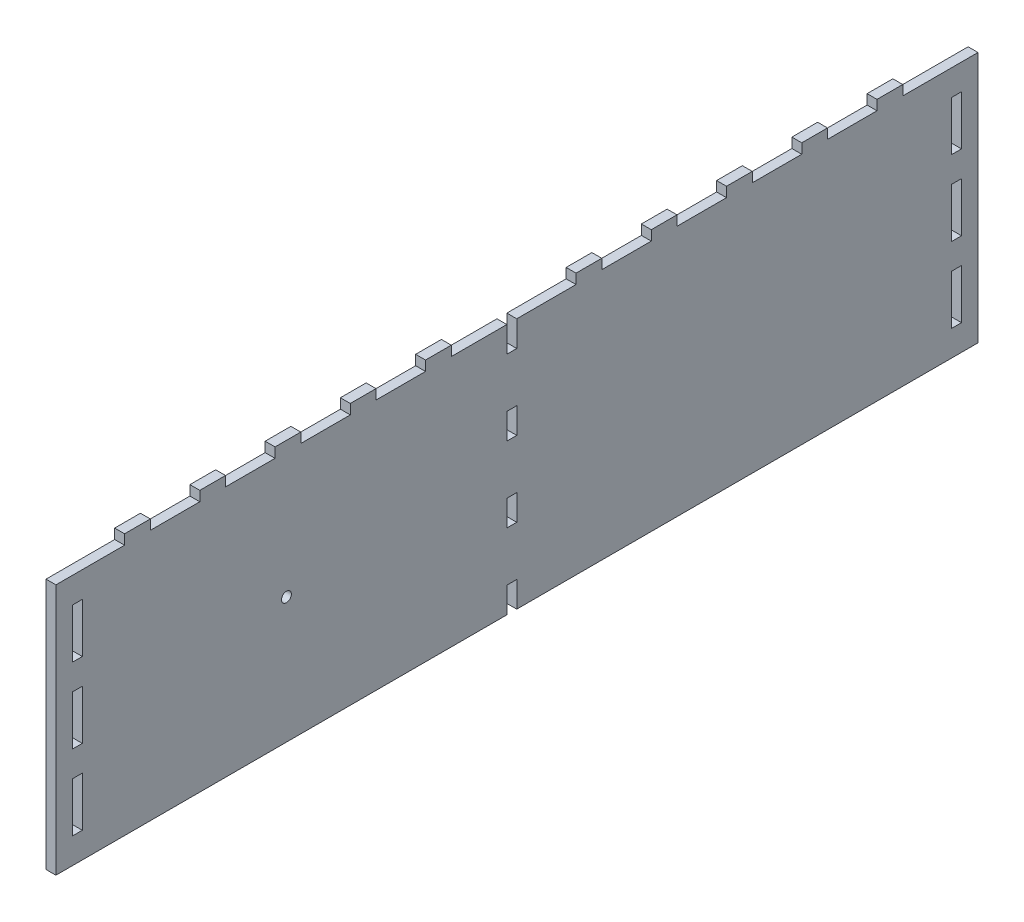
from build123d import *

# Parameters (mm, degrees)
SKETCH1_W                       = 279.4
SKETCH1_H                       = 76.2
BOSS_EXTRUDE1_DEPTH             = 3
SKETCH3_W                       = 3
SKETCH3_H                       = 15
CUT_EXTRUDE1_DEPTH              = 145.833352512
LPATTERN1_COUNT                 = 3
LPATTERN1_PITCH                 = 22.8
MIRROR1_COPY_1_SKETCH_W         = 3
MIRROR1_COPY_1_SKETCH_H         = 15
MIRROR1_COPY_1_DEPTH            = 145.833352512
MIRROR1_COPY_2_SKETCH_W         = 3
MIRROR1_COPY_2_SKETCH_H         = 15
MIRROR1_COPY_2_DEPTH            = 145.833352512
MIRROR1_COPY_3_SKETCH_W         = 3
MIRROR1_COPY_3_SKETCH_H         = 15
MIRROR1_COPY_3_DEPTH            = 145.833352512
F_3_0MM_CLEARANCE_DOWEL_HOLE1_D = 3
SKETCH6_W                       = 3
SKETCH6_H                       = 7.8
CUT_EXTRUDE2_DEPTH              = 145.833352512
LPATTERN2_COUNT                 = 4
LPATTERN2_PITCH                 = 22.8
SKETCH8_W                       = 3
SKETCH8_H                       = 7.8
BOSS_EXTRUDE2_DEPTH             = 3
LPATTERN4_COUNT                 = 11
LPATTERN4_PITCH                 = 22.8


with BuildPart() as part:
    # Sketch1 → Boss-Extrude1 (new body)
    with BuildSketch(Plane(origin=(0, 0, 0), x_dir=(0, 0, -1), z_dir=(1, 0, 0))):
        Rectangle(SKETCH1_W, SKETCH1_H)
    extrude(amount=-BOSS_EXTRUDE1_DEPTH)

    # Sketch3 → Cut-Extrude1 (cut, through all)
    with BuildSketch(Plane.ZY.offset(3)):
        with Locations((133.2, 22.8)):
            Rectangle(SKETCH3_W, SKETCH3_H)
    cut_extrude1 = extrude(amount=-CUT_EXTRUDE1_DEPTH, mode=Mode.SUBTRACT)

    # LPattern1: Cut-Extrude1 ×3
    with Locations(*[(0, -i * LPATTERN1_PITCH, 0) for i in range(1, LPATTERN1_COUNT)]):
        add(cut_extrude1, mode=Mode.SUBTRACT)

    # Mirror1 copy 1 sketch → Mirror1 copy 1 (cut, through all)
    with BuildSketch(Plane(origin=(-3, -22.8, 0), x_dir=(0, 0, -1), z_dir=(-1, 0, 0))):
        with Locations((133.2, -22.8)):
            Rectangle(MIRROR1_COPY_1_SKETCH_W, MIRROR1_COPY_1_SKETCH_H)
    extrude(amount=-MIRROR1_COPY_1_DEPTH, mode=Mode.SUBTRACT)

    # Mirror1 copy 2 sketch → Mirror1 copy 2 (cut, through all)
    with BuildSketch(Plane(origin=(-3, -45.6, 0), x_dir=(0, 0, -1), z_dir=(-1, 0, 0))):
        with Locations((133.2, -22.8)):
            Rectangle(MIRROR1_COPY_2_SKETCH_W, MIRROR1_COPY_2_SKETCH_H)
    extrude(amount=-MIRROR1_COPY_2_DEPTH, mode=Mode.SUBTRACT)

    # Mirror1 copy 3 sketch → Mirror1 copy 3 (cut, through all)
    with BuildSketch(Plane(origin=(-3, 0, 0), x_dir=(0, 0, -1), z_dir=(-1, 0, 0))):
        with Locations((133.2, -22.8)):
            Rectangle(MIRROR1_COPY_3_SKETCH_W, MIRROR1_COPY_3_SKETCH_H)
    extrude(amount=-MIRROR1_COPY_3_DEPTH, mode=Mode.SUBTRACT)

    # Ø3.0mm Clearance Dowel Hole1 (through all)
    with Locations(Plane.ZY.offset(3)):
        with Locations((69.85, 0)):
            Hole(F_3_0MM_CLEARANCE_DOWEL_HOLE1_D / 2)

    # Sketch6 → Cut-Extrude2 (cut, through all)
    with BuildSketch(Plane.ZY.offset(3)):
        with Locations((1.56, 34.2)):
            Rectangle(SKETCH6_W, SKETCH6_H)
    cut_extrude2 = extrude(amount=-CUT_EXTRUDE2_DEPTH, mode=Mode.SUBTRACT)

    # LPattern2: Cut-Extrude2 ×4
    with Locations(*[(0, -i * LPATTERN2_PITCH, 0) for i in range(1, LPATTERN2_COUNT)]):
        add(cut_extrude2, mode=Mode.SUBTRACT)

    # Sketch8 → Boss-Extrude2 (add)
    with BuildSketch(Plane(origin=(0, 38.1, 0), x_dir=(1, 0, 0), z_dir=(0, 1, 0))):
        with Locations((-1.5, 113)):
            Rectangle(SKETCH8_W, SKETCH8_H)
    boss_extrude2 = extrude(amount=BOSS_EXTRUDE2_DEPTH)

    # LPattern4: Boss-Extrude2 ×11, 1 skipped
    with Locations(*[(0, 0, i * LPATTERN4_PITCH) for i in range(1, LPATTERN4_COUNT) if i not in (5,)]):
        add(boss_extrude2)


solid = part.part
